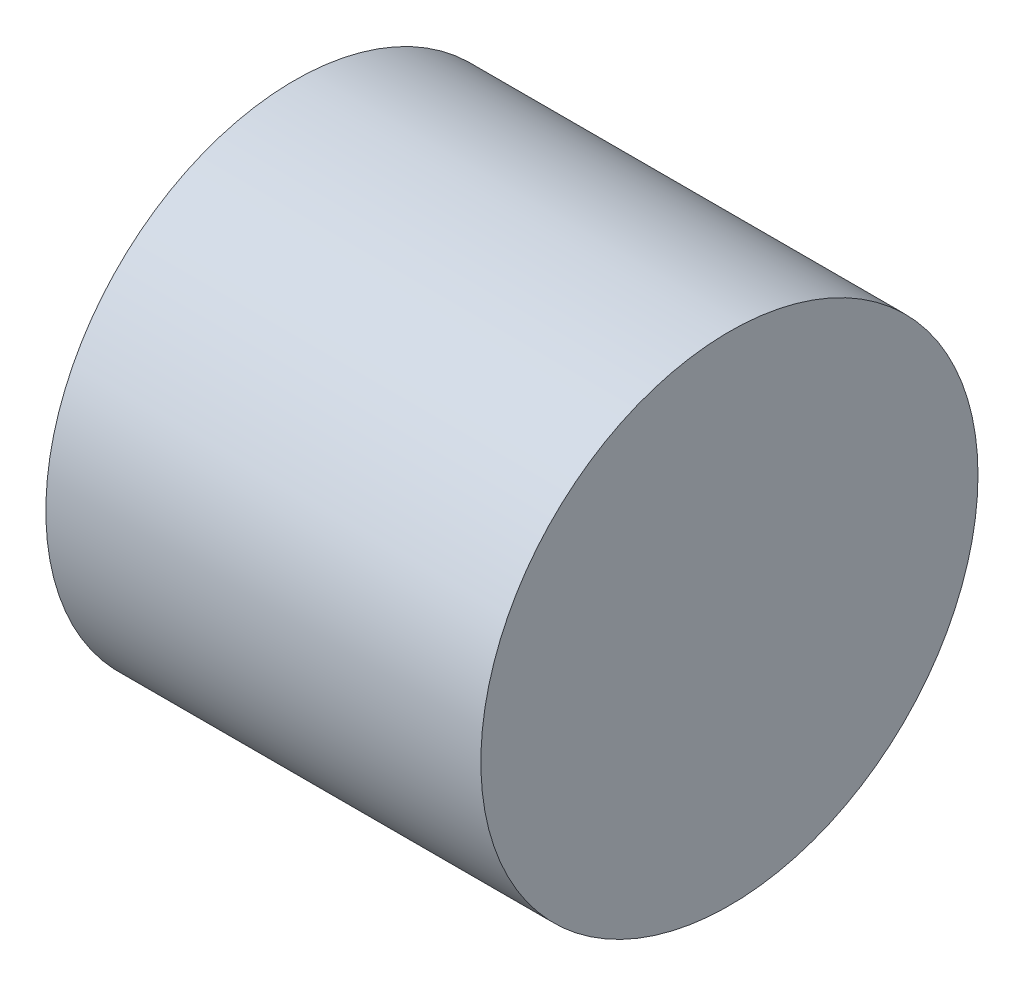
from build123d import *

# Parameters (mm, degrees)
SKETCH1_R           = 50.8
BOSS_EXTRUDE1_DEPTH = 88.9


with BuildPart() as part:
    # Sketch1 → Boss-Extrude1 (new body)
    with BuildSketch(Plane(origin=(0, 0, 0), x_dir=(0, 0, -1), z_dir=(1, 0, 0))):
        Circle(SKETCH1_R)
    extrude(amount=BOSS_EXTRUDE1_DEPTH)


solid = part.part
